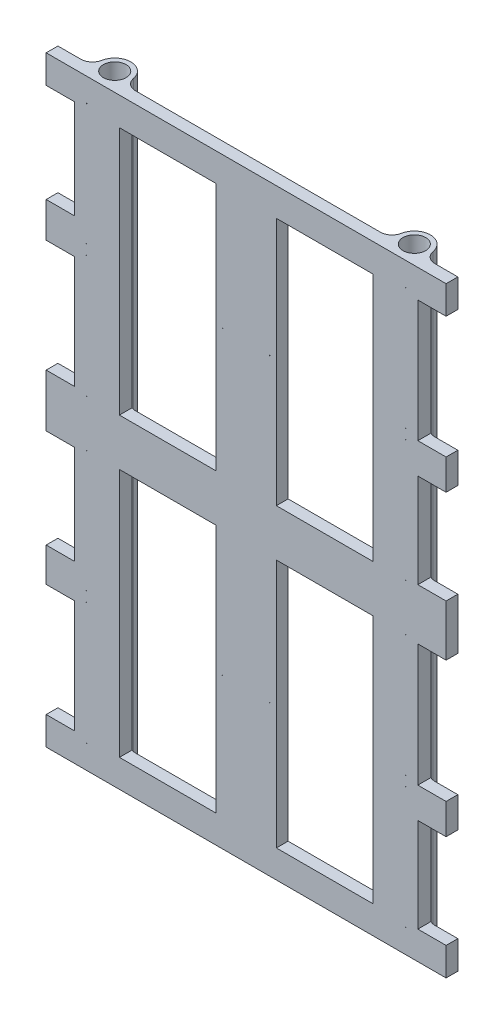
from build123d import *

# Parameters (mm, degrees)
SKETCH1_R                        = 4.825
BOSS_EXTRUDE1_DEPTH              = 255.6
CUT_EXTRUDE2_DEPTH               = 270.535858514
CUT_EXTRUDE2_DEPTH_BACK          = 270.535858514
SKETCH2_W                        = 41
SKETCH2_H                        = 106
SKETCH2_H_2                      = 105.8
SKETCH2_W_2                      = 20
SKETCH2_H_3                      = 40
SKETCH2_H_4                      = 51.8
SKETCH2_H_5                      = 52
SKETCH2_H_6                      = 42
SKETCH2_H_7                      = 47.8
SKETCH2_H_8                      = 47.9
F_0_25_0_25_DIAMETER_HOLE1_D     = 0.25
F_0_25_0_25_DIAMETER_HOLE1_DEPTH = 1.924892423
F_0_25_0_25_DIAMETER_HOLE1_TIP   = 0.075107577


with BuildPart() as part:
    # Sketch1 → Boss-Extrude1 (new body)
    with BuildSketch(Plane(origin=(0, 0, 0), x_dir=(1, 0, 0), z_dir=(0, 1, 0))):
        with BuildLine():
            Line((85, -5), (85, 0))
            Line((85, 0), (75.304187068, 0))
            ThreePointArc((75.304187068, 0), (72.10948347, 1.153720119), (70.389097399, 4.082452431))
            ThreePointArc((70.389097399, 4.082452431), (63.68, 9.655), (56.970902601, 4.082452431))
            ThreePointArc((56.970902601, 4.082452431), (55.25051653, 1.153720119), (52.055812932, 0))
            Line((52.055812932, 0), (-52.055812932, 0))
            ThreePointArc((-52.055812932, 0), (-55.25051653, 1.153720119), (-56.970902601, 4.082452431))
            ThreePointArc((-56.970902601, 4.082452431), (-63.68, 9.655), (-70.389097399, 4.082452431))
            ThreePointArc((-70.389097399, 4.082452431), (-72.10948347, 1.153720119), (-75.304187068, 0))
            Line((-75.304187068, 0), (-85, 0))
            Line((-85, 0), (-85, -5))
            Line((-85, -5), (85, -5))
        make_face()
        with Locations((-63.68, 2.83)):
            Circle(SKETCH1_R, mode=Mode.SUBTRACT)
        with Locations((63.68, 2.83)):
            Circle(SKETCH1_R, mode=Mode.SUBTRACT)
    extrude(amount=BOSS_EXTRUDE1_DEPTH)

    # Sketch2 → Cut-Extrude2 (cut, two sides: drawn at the far end of the back side and taken through both)
    with BuildSketch(Plane(origin=(0, 0, 0), x_dir=(-1, 0, 0), z_dir=(0, 0, -1)).offset(-CUT_EXTRUDE2_DEPTH_BACK)):
        with Locations((-33.355, 64.8)):
            Rectangle(SKETCH2_W, SKETCH2_H)
        with Locations((-33.355, 190.7)):
            Rectangle(SKETCH2_W, SKETCH2_H_2)
        with Locations((-83, 158.8)):
            Rectangle(SKETCH2_W_2, SKETCH2_H_3)
        with Locations((33.355, 64.8)):
            Rectangle(SKETCH2_W, SKETCH2_H)
        with Locations((33.355, 190.7)):
            Rectangle(SKETCH2_W, SKETCH2_H_2)
        with Locations((-83, 32)):
            Rectangle(SKETCH2_W_2, SKETCH2_H_3)
        with Locations((-83, 217.7)):
            Rectangle(SKETCH2_W_2, SKETCH2_H_4)
        with Locations((-83, 91)):
            Rectangle(SKETCH2_W_2, SKETCH2_H_5)
        with Locations((83, 222.6)):
            Rectangle(SKETCH2_W_2, SKETCH2_H_6)
        with Locations((83, 95.4)):
            Rectangle(SKETCH2_W_2, SKETCH2_H_6)
        with Locations((83, 162.7)):
            Rectangle(SKETCH2_W_2, SKETCH2_H_7)
        with Locations((83, 35.95)):
            Rectangle(SKETCH2_W_2, SKETCH2_H_8)
    extrude(amount=CUT_EXTRUDE2_DEPTH + CUT_EXTRUDE2_DEPTH_BACK, mode=Mode.SUBTRACT)

    # Ø0.25 (0.25) Diameter Hole1
    with Locations(Plane.XY.offset(5)):
        with Locations((67.775, 10.025), (67.775, 245.575), (67.9, 193.825), (10.025, 191.7), (67.9, 189.575), (67.775, 137.825), (-67.775, 137.825), (-67.9, 189.575), (-67.9, 193.825), (-67.775, 245.575), (-10.025, 191.7), (-10.025, 63.9), (-67.775, 10.025), (-67.9, 61.775), (-67.9, 66.025), (-67.775, 117.775), (67.775, 117.775), (67.9, 66.025), (10.025, 63.9), (67.9, 61.775)):
            Hole(F_0_25_0_25_DIAMETER_HOLE1_D / 2, depth=F_0_25_0_25_DIAMETER_HOLE1_DEPTH)
            with Locations((0, 0, -(F_0_25_0_25_DIAMETER_HOLE1_DEPTH + F_0_25_0_25_DIAMETER_HOLE1_TIP / 2))):  # 118° drill point
                Cone(0, F_0_25_0_25_DIAMETER_HOLE1_D / 2, F_0_25_0_25_DIAMETER_HOLE1_TIP, mode=Mode.SUBTRACT)


solid = part.part
